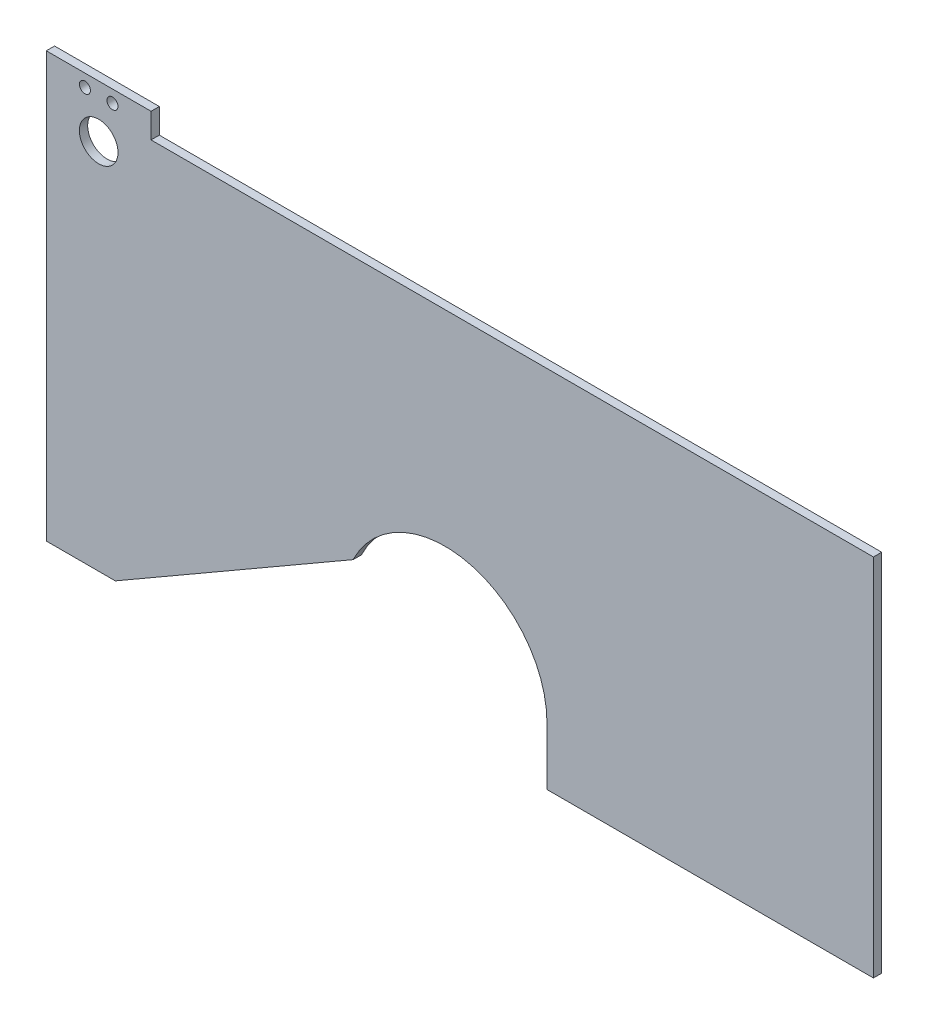
from build123d import *

# Parameters (mm, degrees)
SKETCH2_R           = 7
SKETCH2_R_2         = 2
BOSS_EXTRUDE2_DEPTH = 3
SKETCH3_W           = 118.4
SKETCH3_H           = 12.75
CUT_EXTRUDE1_DEPTH  = 338.231374578


with BuildPart() as part:
    # Sketch2 → Boss-Extrude2 (new body)
    with BuildSketch(Plane.XY):
        with BuildLine():
            Line((25.03035901, 0), (111.286489227, 49.8))
            ThreePointArc((111.286489227, 49.8), (152.858332199, 69.766604349), (181.6, 33.7))
            Line((181.6, 33.7), (181.6, 0))
            Line((181.6, 0), (300, 0))
            Line((300, 0), (300, 145))
            Line((300, 145), (38, 145))
            Line((38, 145), (38, 154))
            Line((38, 154), (19, 154))
            Line((19, 154), (0, 154))
            Line((0, 154), (0, 0))
            Line((0, 0), (25.03035901, 0))
        make_face()
        with Locations((19, 135)):
            Circle(SKETCH2_R, mode=Mode.SUBTRACT)
        with Locations((14, 149.5)):
            Circle(SKETCH2_R_2, mode=Mode.SUBTRACT)
        with Locations((24, 149.5)):
            Circle(SKETCH2_R_2, mode=Mode.SUBTRACT)
    extrude(amount=BOSS_EXTRUDE2_DEPTH)

    # Sketch3 → Cut-Extrude1 (cut, through all)
    with BuildSketch(Plane.XY.offset(3)):
        with Locations((240.8, 6.375)):
            Rectangle(SKETCH3_W, SKETCH3_H)
    extrude(amount=-CUT_EXTRUDE1_DEPTH, mode=Mode.SUBTRACT)


solid = part.part
